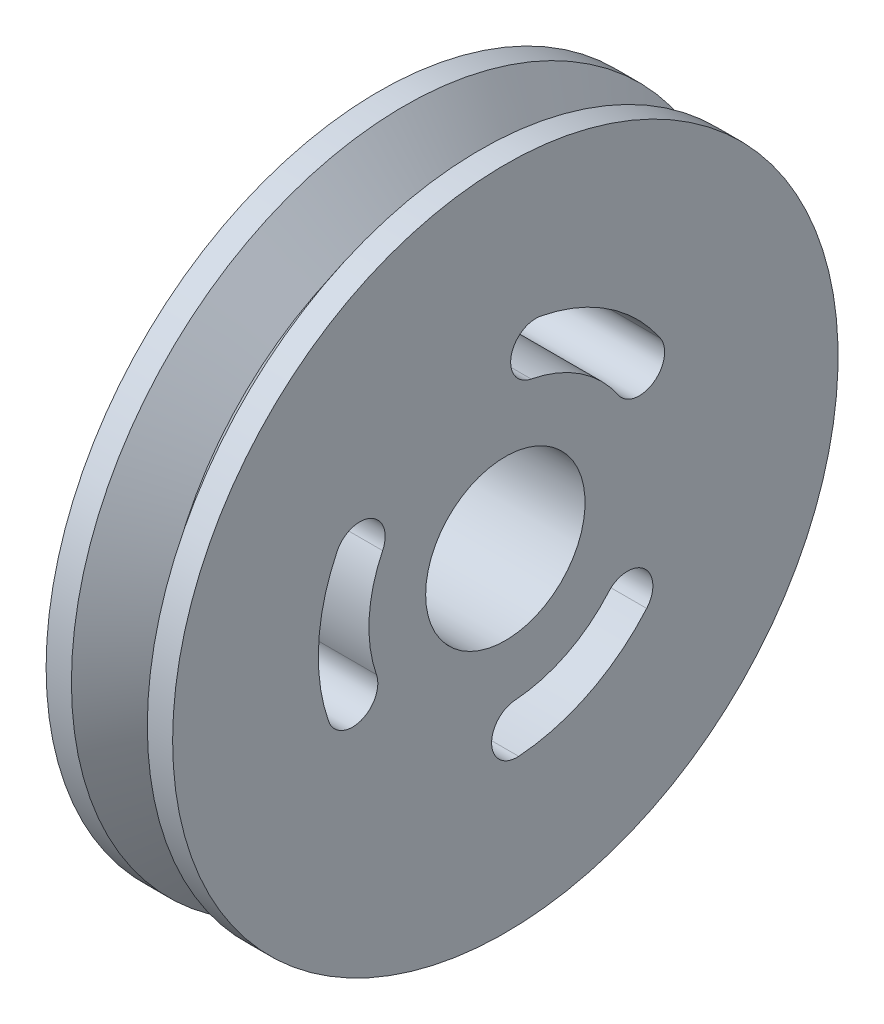
from build123d import *

# Parameters (mm, degrees)
CUT_EXTRUDE1_DEPTH      = 25.4561342
CUT_EXTRUDE1_DEPTH_BACK = 25.4561342


with BuildPart() as part:
    # Sketch1 → Revolve1 (revolve)
    with BuildSketch(Plane.XY):
        Polygon((1.27, 16.7), (3.175, 14.16), (5.08, 16.7), (6.35, 16.7), (6.35, 4), (0, 4), (0, 16.7), align=None)
    revolve(axis=Axis((0, 0, 0), (1, 0, 0)))

    # Sketch2 → Cut-Extrude1 (cut, two sides: drawn at the far end of the back side and taken through both)
    with BuildSketch(Plane.ZY.offset(-CUT_EXTRUDE1_DEPTH_BACK)):
        with BuildLine():
            ThreePointArc((-5.174909182, -4.484253782), (-6.96638667, -4.356158459), (-7.094481993, -6.147635947))
            ThreePointArc((-7.094481993, -6.147635947), (-4.201848282, -8.394615744), (-0.66952126, -9.363591392))
            ThreePointArc((-0.66952126, -9.363591392), (0.687821691, -8.187402584), (-0.488367117, -6.830059633))
            ThreePointArc((-0.488367117, -6.830059633), (-3.064943047, -6.123262296), (-5.174909182, -4.484253782))
        make_face()
        with BuildLine():
            ThreePointArc((-1.296023102, 6.723729704), (-0.289350555, 8.211147057), (-1.776767907, 9.217819605))
            ThreePointArc((-1.776767907, 9.217819605), (-5.169026349, 7.836215226), (-7.774347387, 5.261618115))
            ThreePointArc((-7.774347387, 5.261618115), (-7.434409475, 3.498030233), (-5.670821594, 3.837968145))
            ThreePointArc((-5.670821594, 3.837968145), (-3.77042918, 5.715949687), (-1.296023102, 6.723729704))
        make_face()
        with BuildLine():
            ThreePointArc((6.470932282, -2.239475923), (7.255737222, -3.854988599), (8.871249898, -3.070183659))
            ThreePointArc((8.871249898, -3.070183659), (9.370874629, 0.558400517), (8.443868645, 4.101973277))
            ThreePointArc((8.443868645, 4.101973277), (6.746587782, 4.68937235), (6.159188708, 2.992091487))
            ThreePointArc((6.159188708, 2.992091487), (6.835372224, 0.407312608), (6.470932282, -2.239475923))
        make_face()
    extrude(amount=CUT_EXTRUDE1_DEPTH + CUT_EXTRUDE1_DEPTH_BACK, mode=Mode.SUBTRACT)


solid = part.part
